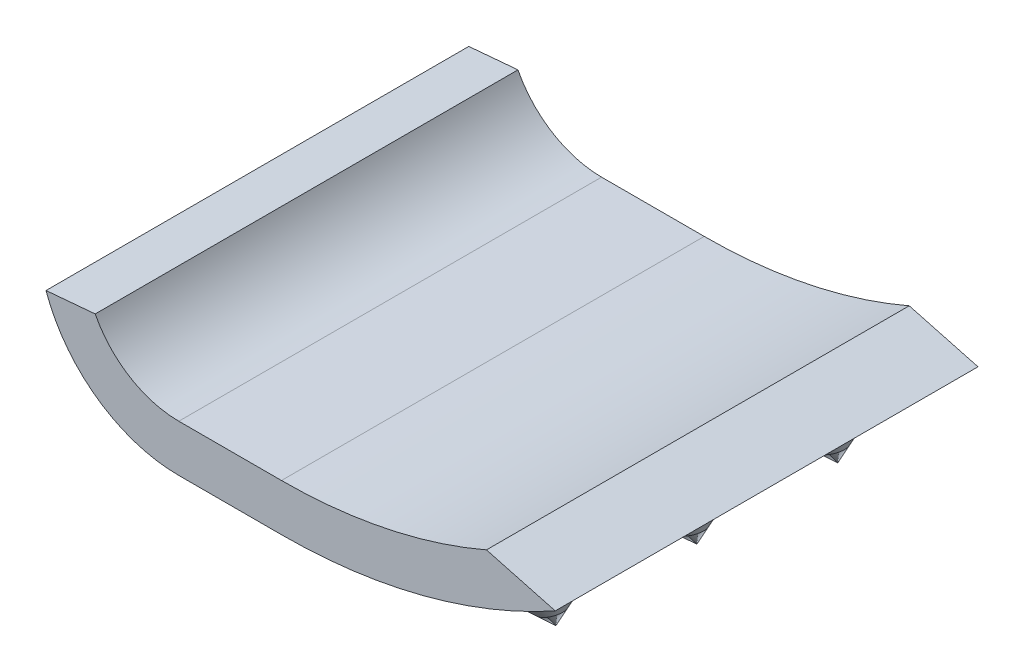
from build123d import *

# Parameters (mm, degrees)
BOSS_EXTRUDE1_DEPTH        = 14.2875
SKETCH2_R                  = 1.5875
BOSS_EXTRUDE2_DEPTH        = 1.5875
CHAMFER1_SIZE              = 1.5875
BOSS_EXTRUDE3_DEPTH        = 1.5875
BOSS_EXTRUDE3_DEPTH_BACK   = 0.79375
SKETCH3_R                  = 1.5875
CHAMFER2_SIZE              = 1.5875
BOSS_EXTRUDE4_DEPTH        = 1.5875
BOSS_EXTRUDE4_DEPTH_BACK   = 0.79375
SKETCH5_R                  = 1.5875
BOSS_EXTRUDE4_2_DEPTH      = 1.5875
BOSS_EXTRUDE4_2_DEPTH_BACK = 0.79375
BOSS_EXTRUDE4_3_DEPTH      = 1.5875
BOSS_EXTRUDE4_3_DEPTH_BACK = 0.79375
CHAMFER3_SIZE              = 1.5875
CHAMFER4_SIZE              = 1.5875
CHAMFER5_SIZE              = 1.5875
BOSS_EXTRUDE5_DEPTH        = 1.5875
BOSS_EXTRUDE5_DEPTH_BACK   = 0.79375
SKETCH6_R                  = 1.5875
CHAMFER6_SIZE              = 1.5875


with BuildPart() as part:
    # Sketch1 → Boss-Extrude1 (new body)
    with BuildSketch(Plane.XY):
        with BuildLine():
            Line((-1.73482, 0), (1.73482, 0))
            ThreePointArc((1.73482, 0), (6.513582382, 0.609123391), (10.98674309, 2.397540147))
            Line((10.98674309, 2.397540147), (8.662299056, 3.020373049))
            ThreePointArc((8.662299056, 3.020373049), (5.271877083, 1.949469791), (1.73482, 1.5875))
            Line((1.73482, 1.5875), (-1.73482, 1.5875))
            ThreePointArc((-1.73482, 1.5875), (-3.390629266, 2.053455764), (-4.560432944, 3.314557843))
            Line((-4.560432944, 3.314557843), (-6.222862733, 3.169114083))
            ThreePointArc((-6.222862733, 3.169114083), (-4.481900798, 0.872133264), (-1.73482, 0))
        make_face()
    extrude(amount=BOSS_EXTRUDE1_DEPTH)

    # Sketch2 → Boss-Extrude2 (add)
    with BuildSketch(Plane.XZ):
        with Locations(Location((0, 2.38125, 0), (0, 0, 90))):
            Circle(SKETCH2_R)
        with Locations(Location((0, 7.14375, 0), (0, 0, 90))):
            Circle(SKETCH2_R)
        with Locations(Location((0, 11.90625, 0), (0, 0, 90))):
            Circle(SKETCH2_R)
    extrude(amount=BOSS_EXTRUDE2_DEPTH)

    # Chamfer1
    chamfer1_edges = [part.edges().sort_by_distance(p)[0] for p in [
        (0, -1.5875, 0.79375),
        (0, -1.5875, 5.55625),
        (0, -1.5875, 10.31875),
    ]]
    chamfer(chamfer1_edges, length=CHAMFER1_SIZE - 0.0001)  # a hair under: the kernel refuses the full size

    # Sketch3 → Boss-Extrude3 (add, two sides: drawn at the far end of the back side and taken through both)
    with BuildSketch(Plane(origin=(-0.752732007, -1.303770081, 0), x_dir=(0, 0, -1), z_dir=(-0.500000000000001, -0.866025403784438, 0)).offset(-BOSS_EXTRUDE3_DEPTH_BACK)):
        with Locations(Location((-2.38125, -3.798714252, 0), (0, 0, 90))):
            Circle(SKETCH3_R)
        with Locations(Location((-7.14375, -3.798714252, 0), (0, 0, 90))):
            Circle(SKETCH3_R)
        with Locations(Location((-11.90625, -3.798714252, 0), (0, 0, 90))):
            Circle(SKETCH3_R)
    extrude(amount=BOSS_EXTRUDE3_DEPTH + BOSS_EXTRUDE3_DEPTH_BACK)

    # Chamfer2
    chamfer2_edges = [part.edges().sort_by_distance(p)[0] for p in [
        (-6.21108038, 0.014521717, 2.38125),
        (-6.21108038, 0.014521717, 7.14375),
        (-6.21108038, 0.014521717, 11.90625),
    ]]
    chamfer(chamfer2_edges, length=CHAMFER2_SIZE - 0.0001)  # a hair under: the kernel refuses the full size

    # Sketch6 → Boss-Extrude5 (add, two sides: drawn at the far end of the back side and taken through both)
    with BuildSketch(Plane(origin=(0.595867138, -1.637131506, 0), x_dir=(0, 0, -1), z_dir=(0.34202014332566943, -0.9396926207859081, 0)).offset(-BOSS_EXTRUDE5_DEPTH_BACK)):
        with Locations(Location((-11.90625, 7.969168433, 0), (0, 0, 90))):
            Circle(SKETCH6_R)
        with Locations(Location((-7.14375, 7.969168433, 0), (0, 0, 90))):
            Circle(SKETCH6_R)
        with Locations(Location((-2.38125, 7.969168433, 0), (0, 0, 90))):
            Circle(SKETCH6_R)
    extrude(amount=BOSS_EXTRUDE5_DEPTH + BOSS_EXTRUDE5_DEPTH_BACK)

    # Chamfer6
    chamfer6_edges = [part.edges().sort_by_distance(p)[0] for p in [
        (7.13563085, -0.946234389, 11.90625),
        (7.13563085, -0.946234389, 7.14375),
        (7.13563085, -0.946234389, 2.38125),
    ]]
    chamfer(chamfer6_edges, length=CHAMFER6_SIZE - 0.0001)  # a hair under: the kernel refuses the full size


with BuildPart() as body_2:
    # Sketch5 → Boss-Extrude4 (new, two sides: drawn at the far end of the back side and taken through both)
    with BuildSketch(Plane(origin=(0.04307072, -0.350782867, 0), x_dir=(0, 0, -1), z_dir=(0.12186934340514774, -0.992546151641322, 0)).offset(-BOSS_EXTRUDE4_DEPTH_BACK)):
        with Locations(Location((-7.14375, 4.103138915, 0), (0, 0, 90))):
            Circle(SKETCH5_R)
    extrude(amount=BOSS_EXTRUDE4_DEPTH + BOSS_EXTRUDE4_DEPTH_BACK)

    # Chamfer4
    chamfer4_edges = [body_2.edges().sort_by_distance(p)[0] for p in [
        (2.733426027, -1.61987062, 7.14375),
    ]]
    chamfer(chamfer4_edges, length=CHAMFER4_SIZE - 0.0001)  # a hair under: the kernel refuses the full size


with BuildPart() as body_3:
    # Sketch5 → Boss-Extrude4 2 (new, two sides: drawn at the far end of the back side and taken through both)
    with BuildSketch(Plane(origin=(0.04307072, -0.350782867, 0), x_dir=(0, 0, -1), z_dir=(0.12186934340514774, -0.992546151641322, 0)).offset(-BOSS_EXTRUDE4_2_DEPTH_BACK)):
        with Locations(Location((-2.38125, 4.103138915, 0), (0, 0, 90))):
            Circle(SKETCH5_R)
    extrude(amount=BOSS_EXTRUDE4_2_DEPTH + BOSS_EXTRUDE4_2_DEPTH_BACK)

    # Chamfer5
    chamfer5_edges = [body_3.edges().sort_by_distance(p)[0] for p in [
        (2.733426027, -1.61987062, 2.38125),
    ]]
    chamfer(chamfer5_edges, length=CHAMFER5_SIZE - 0.0001)  # a hair under: the kernel refuses the full size


with BuildPart() as body_4:
    # Sketch5 → Boss-Extrude4 3 (new, two sides: drawn at the far end of the back side and taken through both)
    with BuildSketch(Plane(origin=(0.04307072, -0.350782867, 0), x_dir=(0, 0, -1), z_dir=(0.12186934340514774, -0.992546151641322, 0)).offset(-BOSS_EXTRUDE4_3_DEPTH_BACK)):
        with Locations(Location((-11.90625, 4.103138915, 0), (0, 0, 90))):
            Circle(SKETCH5_R)
    extrude(amount=BOSS_EXTRUDE4_3_DEPTH + BOSS_EXTRUDE4_3_DEPTH_BACK)

    # Chamfer3
    chamfer3_edges = [body_4.edges().sort_by_distance(p)[0] for p in [
        (2.733426027, -1.61987062, 11.90625),
    ]]
    chamfer(chamfer3_edges, length=CHAMFER3_SIZE - 0.0001)  # a hair under: the kernel refuses the full size


solid = Compound([part.part, body_2.part, body_3.part, body_4.part])
